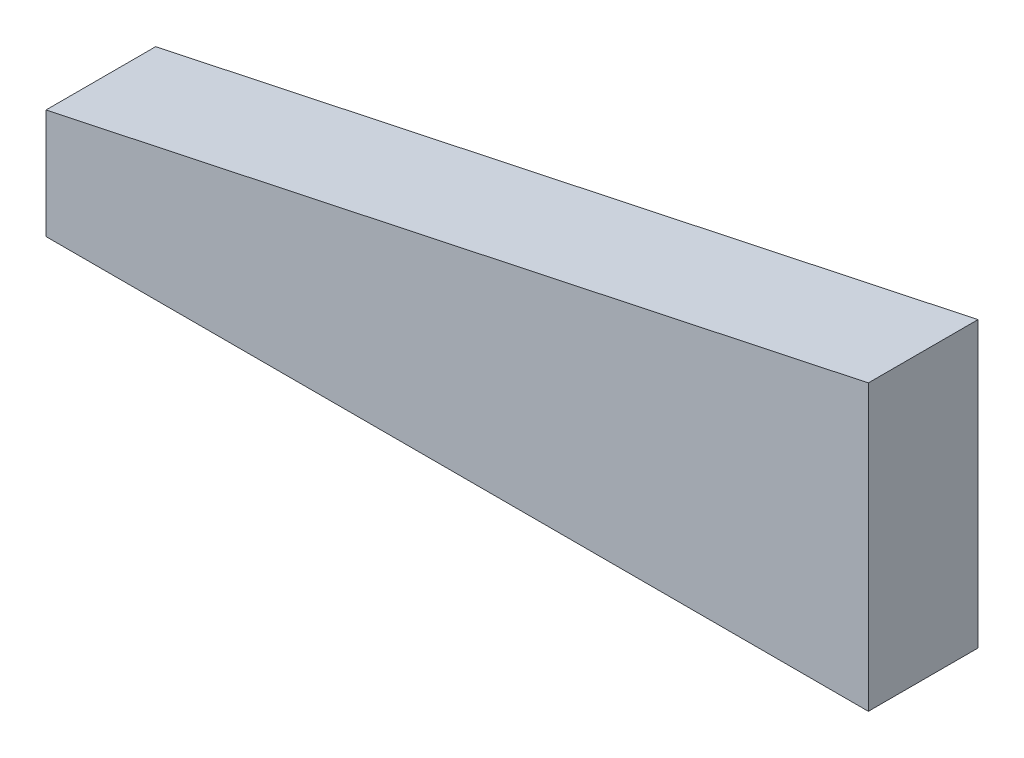
from build123d import *

# Parameters (mm, degrees)
SKETCH1_W           = 150
SKETCH1_H           = 20
BOSS_EXTRUDE1_DEPTH = 10
BOSS_EXTRUDE2_DEPTH = 10


with BuildPart() as part:
    # Sketch1 → Boss-Extrude1 (new, symmetric)
    with BuildSketch(Plane(origin=(0, 0, 0), x_dir=(1, 0, 0), z_dir=(0, 1, 0))):
        Rectangle(SKETCH1_W, SKETCH1_H)
    extrude(amount=BOSS_EXTRUDE1_DEPTH, both=True)

    # Sketch2 → Boss-Extrude2 (add, symmetric)
    with BuildSketch(Plane.XY):
        Polygon((-75, 10), (75, 10), (75, 41.883484251), align=None)
    extrude(amount=BOSS_EXTRUDE2_DEPTH, both=True)


solid = part.part
